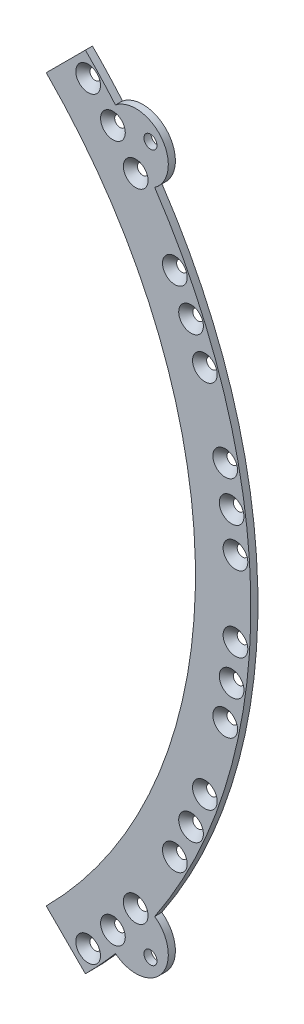
from build123d import *

# Parameters (mm, degrees)
SKETCH1_R           = 1.5
BOSS_EXTRUDE1_DEPTH = 2
CUT_EXTRUDE1_DEPTH  = 197.459257863
CHAMFER1_SIZE       = 2
BOSS_EXTRUDE2_DEPTH = 2
CUT_EXTRUDE2_DEPTH  = 197.398014273
SKETCH5_R           = 1.85
CUT_EXTRUDE3_DEPTH  = 197.398014273


with BuildPart() as part:
    # Sketch1 → Boss-Extrude1 (new body)
    with BuildSketch(Plane.XY):
        with BuildLine():
            Line((102.318351238, 102.318351238), (113.419927702, 113.419927702))
            ThreePointArc((113.419927702, 113.419927702), (160.4, 0), (113.419927702, -113.419927702))
            Line((113.419927702, -113.419927702), (102.318351238, -102.318351238))
            ThreePointArc((102.318351238, -102.318351238), (144.7, 0), (102.318351238, 102.318351238))
        make_face()
        with Locations((121.321245866, 98.702154493)):
            Circle(SKETCH1_R, mode=Mode.SUBTRACT)
        with Locations((143.451847555, 62.309930452)):
            Circle(SKETCH1_R, mode=Mode.SUBTRACT)
        with Locations((154.94328196, 21.296463919)):
            Circle(SKETCH1_R, mode=Mode.SUBTRACT)
        with Locations((154.94328196, -21.296463919)):
            Circle(SKETCH1_R, mode=Mode.SUBTRACT)
        with Locations((143.451847555, -62.309930452)):
            Circle(SKETCH1_R, mode=Mode.SUBTRACT)
        with Locations((121.321245866, -98.702154493)):
            Circle(SKETCH1_R, mode=Mode.SUBTRACT)
        with Locations(Location((127.774091267, 90.192802379, 0), (0, 0, 180))):
            Circle(SKETCH1_R, mode=Mode.SUBTRACT)
        with Locations(Location((147.369608219, 52.375171344, 0), (0, 0, 180))):
            Circle(SKETCH1_R, mode=Mode.SUBTRACT)
        with Locations(Location((153.128751314, 31.820520441, 0), (0, 0, 180))):
            Circle(SKETCH1_R, mode=Mode.SUBTRACT)
        with Locations(Location((156.035395501, 10.67311345, 0), (0, 0, 180))):
            Circle(SKETCH1_R, mode=Mode.SUBTRACT)
        with Locations(Location((127.774091267, -90.192802379, 0), (0, 0, 180))):
            Circle(SKETCH1_R, mode=Mode.SUBTRACT)
        with Locations(Location((147.369608219, -52.375171344, 0), (0, 0, 180))):
            Circle(SKETCH1_R, mode=Mode.SUBTRACT)
        with Locations(Location((153.128751314, -31.820520441, 0), (0, 0, 180))):
            Circle(SKETCH1_R, mode=Mode.SUBTRACT)
        with Locations(Location((156.035395501, -10.67311345, 0), (0, 0, 180))):
            Circle(SKETCH1_R, mode=Mode.SUBTRACT)
        with Locations((138.865248158, 71.954171901)):
            Circle(SKETCH1_R, mode=Mode.SUBTRACT)
        with Locations((114.302744813, 106.751311599)):
            Circle(SKETCH1_R, mode=Mode.SUBTRACT)
        with Locations((138.865248158, -71.954171901)):
            Circle(SKETCH1_R, mode=Mode.SUBTRACT)
        with Locations((114.302744813, -106.751311599)):
            Circle(SKETCH1_R, mode=Mode.SUBTRACT)
    extrude(amount=BOSS_EXTRUDE1_DEPTH)

    # Sketch2 → Cut-Extrude1 (cut, through all)
    with BuildSketch(Plane.XY.offset(2)):
        Polygon((117.10590357, 116.893771535), (92.696291985, 92.484159951), (81.614099529, 103.566352407), (106.023711114, 127.975963992), align=None)
        Polygon((94.953094668, -94.740962634), (127.588403443, -127.376271408), (106.110382849, -148.854292002), (73.475074075, -116.218983227), align=None)
    extrude(amount=-CUT_EXTRUDE1_DEPTH, mode=Mode.SUBTRACT)

    # Chamfer1
    chamfer1_edges = [part.edges().sort_by_distance(p)[0] for p in [
        (119.821245866, 98.702154493, 2),
        (141.951847555, 62.309930452, 2),
        (153.44328196, 21.296463919, 2),
        (153.44328196, -21.296463919, 2),
        (141.951847555, -62.309930452, 2),
        (119.821245866, -98.702154493, 2),
        (129.274091267, 90.192802379, 2),
        (148.869608219, 52.375171344, 2),
        (154.628751314, 31.820520441, 2),
        (157.535395501, 10.67311345, 2),
        (129.274091267, -90.192802379, 2),
        (148.869608219, -52.375171344, 2),
        (154.628751314, -31.820520441, 2),
        (157.535395501, -10.67311345, 2),
        (112.802744813, 106.751311599, 2),
        (137.365248158, 71.954171901, 2),
        (137.365248158, -71.954171901, 2),
        (112.802744813, -106.751311599, 2),
    ]]
    chamfer(chamfer1_edges, length=CHAMFER1_SIZE - 0.0001)  # a hair under: the kernel refuses the full size

    # Sketch3 → Boss-Extrude2 (add)
    with BuildSketch(Plane(origin=(0, 0, 0), x_dir=(-1, 0, 0), z_dir=(0, 0, -1))):
        with BuildLine():
            ThreePointArc((-133.156583772, -89.428654235), (-140.426335781, -106.48865188), (-122.037613507, -104.091214277))
            ThreePointArc((-122.037613507, -104.091214277), (-127.807539871, -96.919516879), (-133.156583772, -89.428654235))
        make_face()
        with BuildLine():
            ThreePointArc((-122.037613507, 104.091214277), (-140.426335781, 106.48865188), (-133.156583772, 89.428654235))
            ThreePointArc((-133.156583772, 89.428654235), (-127.807539871, 96.919516879), (-122.037613507, 104.091214277))
        make_face()
    extrude(amount=-BOSS_EXTRUDE2_DEPTH)

    # Sketch4 → Cut-Extrude2 (cut, through all)
    with BuildSketch(Plane(origin=(0, 0, 0), x_dir=(-1, 0, 0), z_dir=(0, 0, -1))):
        with BuildLine():
            ThreePointArc((-122.037613507, -104.091214277), (-135.141839583, -102.481291915), (-133.156583772, -89.428654235))
            ThreePointArc((-133.156583772, -89.428654235), (-147.070909653, -111.527391302), (-122.037613507, -104.091214277))
        make_face()
        with BuildLine():
            ThreePointArc((-133.156583772, 89.428654235), (-135.141839583, 102.481291915), (-122.037613507, 104.091214277))
            ThreePointArc((-122.037613507, 104.091214277), (-145.081010417, 110.018403078), (-133.156583772, 89.428654235))
        make_face()
    extrude(amount=-CUT_EXTRUDE2_DEPTH, mode=Mode.SUBTRACT)

    # Sketch5 → Cut-Extrude3 (cut, through all)
    with BuildSketch(Plane(origin=(0, 0, 0), x_dir=(-1, 0, 0), z_dir=(0, 0, -1))):
        with Locations((-131.954619137, -100.064346357)):
            Circle(SKETCH5_R)
        with Locations((-131.954619137, 100.064346357)):
            Circle(SKETCH5_R)
    extrude(amount=-CUT_EXTRUDE3_DEPTH, mode=Mode.SUBTRACT)


solid = part.part
